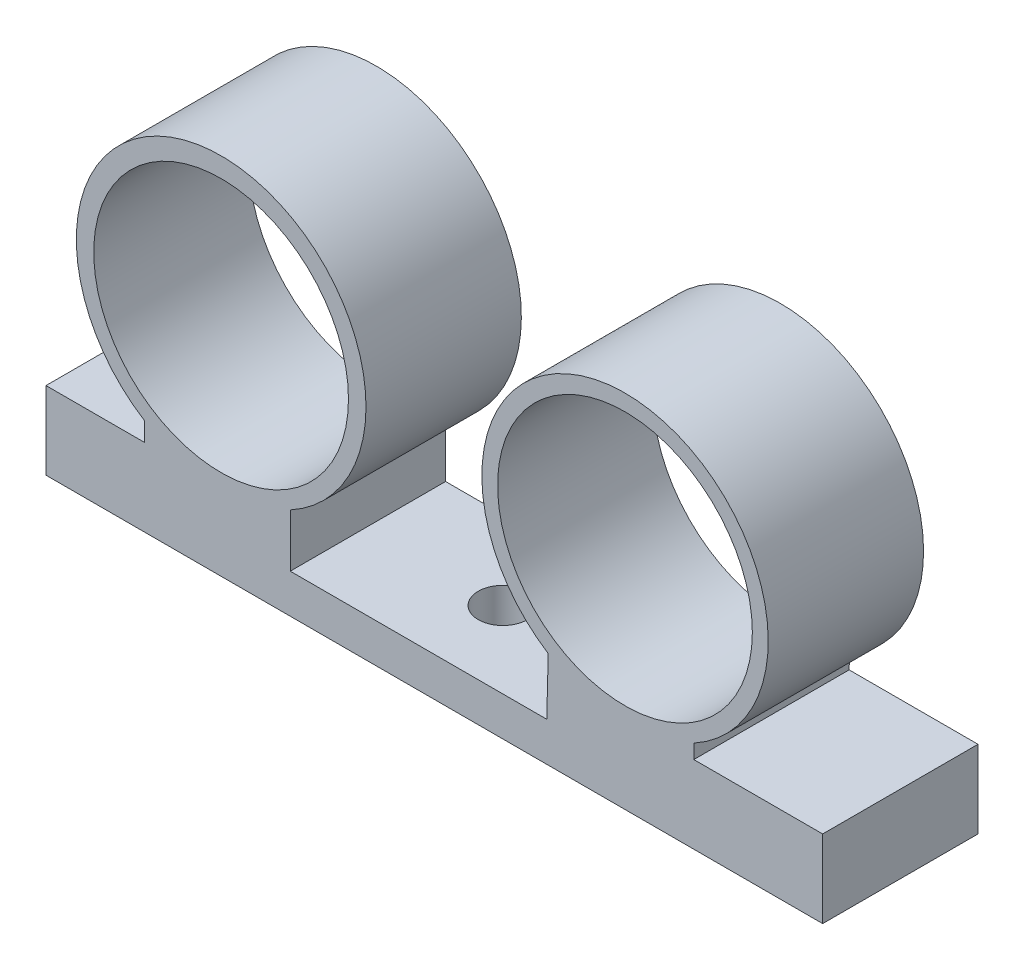
from build123d import *

# Parameters (mm, degrees)
SKETCH1_R           = 8.2
BOSS_EXTRUDE1_DEPTH = 10
SKETCH2_R           = 1.585
CUT_EXTRUDE1_DEPTH  = 10


with BuildPart() as part:
    # Sketch1 → Boss-Extrude1 (new body)
    with BuildSketch(Plane.XY):
        with BuildLine():
            Line((-4.18853286, 12.607697881), (-4.18853286, 11.388086222))
            Line((-4.18853286, 11.388086222), (-10.519480519, 11.388086222))
            Line((-10.519480519, 11.388086222), (-10.519480519, 6.388086222))
            Line((-10.519480519, 6.388086222), (39.480519481, 6.388086222))
            Line((39.480519481, 6.388086222), (39.480519481, 11.388086222))
            Line((39.480519481, 11.388086222), (31.184867488, 11.388086222))
            Line((31.184867488, 11.388086222), (31.208880831, 12.319168637))
            ThreePointArc((31.208880831, 12.319168637), (27.044977059, 29.604195095), (21.813303533, 12.611848983))
            Line((21.813303533, 12.611848983), (21.717585323, 8.900514858))
            Line((21.717585323, 8.900514858), (5.205765597, 8.900514858))
            Line((5.205765597, 8.900514858), (5.205765597, 12.316995042))
            ThreePointArc((5.205765597, 12.316995042), (1.04612148, 29.83226088), (-4.18853286, 12.607697881))
        make_face()
        with Locations((26.753246753, 20.367776119)):
            Circle(SKETCH1_R, mode=Mode.SUBTRACT)
        with Locations((0.753246753, 20.367776119)):
            Circle(SKETCH1_R, mode=Mode.SUBTRACT)
    extrude(amount=BOSS_EXTRUDE1_DEPTH)

    # Sketch2 → Cut-Extrude1 (cut)
    with BuildSketch(Plane(origin=(0, 8.900514858, 0), x_dir=(1, 0, 0), z_dir=(0, 1, 0))):
        with Locations((13.958626021, -5.067111952)):
            Circle(SKETCH2_R)
    extrude(amount=-CUT_EXTRUDE1_DEPTH, mode=Mode.SUBTRACT)


solid = part.part
